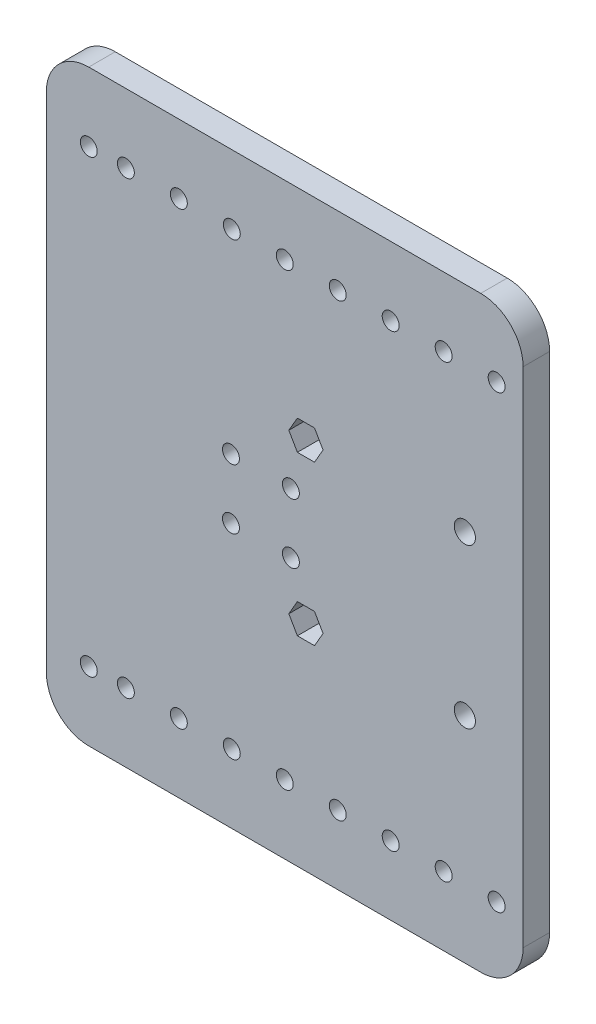
from build123d import *

# Parameters (mm, degrees)
SKETCH_1_W            = 90
SKETCH_1_H            = 111
SKETCH_1_R            = 2
SKETCH_1_R_2          = 1.6
EXTRUDE_1_DEPTH       = 5
FILLET_1_R            = 8
F_3_2_PCD16_R         = 1.6
CUT_EXTRUDE_3_2_DEPTH = 10


with BuildPart() as part:
    # 草图1 → 凸台-拉伸1 (new body)
    with BuildSketch(Plane.XY):
        with Locations((45, -55.5)):
            Rectangle(SKETCH_1_W, SKETCH_1_H)
        with Locations((79, -40.5)):
            Circle(SKETCH_1_R, mode=Mode.SUBTRACT)
        with Locations((79, -70.5)):
            Circle(SKETCH_1_R, mode=Mode.SUBTRACT)
        with Locations((85, -98)):
            Circle(SKETCH_1_R_2, mode=Mode.SUBTRACT)
        with Locations((75, -98)):
            Circle(SKETCH_1_R_2, mode=Mode.SUBTRACT)
        with Locations((65, -98)):
            Circle(SKETCH_1_R_2, mode=Mode.SUBTRACT)
        with Locations((55, -98)):
            Circle(SKETCH_1_R_2, mode=Mode.SUBTRACT)
        with Locations((45, -98)):
            Circle(SKETCH_1_R_2, mode=Mode.SUBTRACT)
        with Locations((85, -13)):
            Circle(SKETCH_1_R_2, mode=Mode.SUBTRACT)
        with Locations((75, -13)):
            Circle(SKETCH_1_R_2, mode=Mode.SUBTRACT)
        with Locations((65, -13)):
            Circle(SKETCH_1_R_2, mode=Mode.SUBTRACT)
        with Locations((55, -13)):
            Circle(SKETCH_1_R_2, mode=Mode.SUBTRACT)
        with Locations((45, -13)):
            Circle(SKETCH_1_R_2, mode=Mode.SUBTRACT)
        with Locations((35, -98)):
            Circle(SKETCH_1_R_2, mode=Mode.SUBTRACT)
        with Locations((25, -98)):
            Circle(SKETCH_1_R_2, mode=Mode.SUBTRACT)
        with Locations((15, -98)):
            Circle(SKETCH_1_R_2, mode=Mode.SUBTRACT)
        with Locations((35, -13)):
            Circle(SKETCH_1_R_2, mode=Mode.SUBTRACT)
        with Locations((25, -13)):
            Circle(SKETCH_1_R_2, mode=Mode.SUBTRACT)
        with Locations((15, -13)):
            Circle(SKETCH_1_R_2, mode=Mode.SUBTRACT)
        with Locations((8, -98)):
            Circle(SKETCH_1_R_2, mode=Mode.SUBTRACT)
        with Locations((8, -13)):
            Circle(SKETCH_1_R_2, mode=Mode.SUBTRACT)
        Polygon((50.616580754, -37.7), (47.383419246, -37.7), (45.766838493, -40.5), (47.383419246, -43.3), (50.616580754, -43.3), (52.233161507, -40.5), align=None, mode=Mode.SUBTRACT)
        Polygon((50.616580754, -67.7), (47.383419246, -67.7), (45.766838493, -70.5), (47.383419246, -73.3), (50.616580754, -73.3), (52.233161507, -70.5), align=None, mode=Mode.SUBTRACT)
    extrude(amount=EXTRUDE_1_DEPTH)

    # 圆角1
    fillet_1_edges = [part.edges().sort_by_distance(p)[0] for p in [
        (0, -111, 2.5),
        (90, -111, 2.5),
        (90, 0, 2.5),
        (0, 0, 2.5),
    ]]
    fillet(fillet_1_edges, radius=FILLET_1_R)

    # 内圈四孔_Ø3.2_PCD16 → 内圈四孔_通孔_Ø3.2 (cut)
    with BuildSketch(Plane(origin=(0, 0, 0), x_dir=(-1, 0, 0), z_dir=(0, 0, -1))):
        with Locations((-46.156854249, -49.843145751)):
            Circle(F_3_2_PCD16_R)
        with Locations((-34.843145751, -49.843145751)):
            Circle(F_3_2_PCD16_R)
        with Locations((-34.843145751, -61.156854249)):
            Circle(F_3_2_PCD16_R)
        with Locations((-46.156854249, -61.156854249)):
            Circle(F_3_2_PCD16_R)
    extrude(amount=-CUT_EXTRUDE_3_2_DEPTH, mode=Mode.SUBTRACT)


solid = part.part
